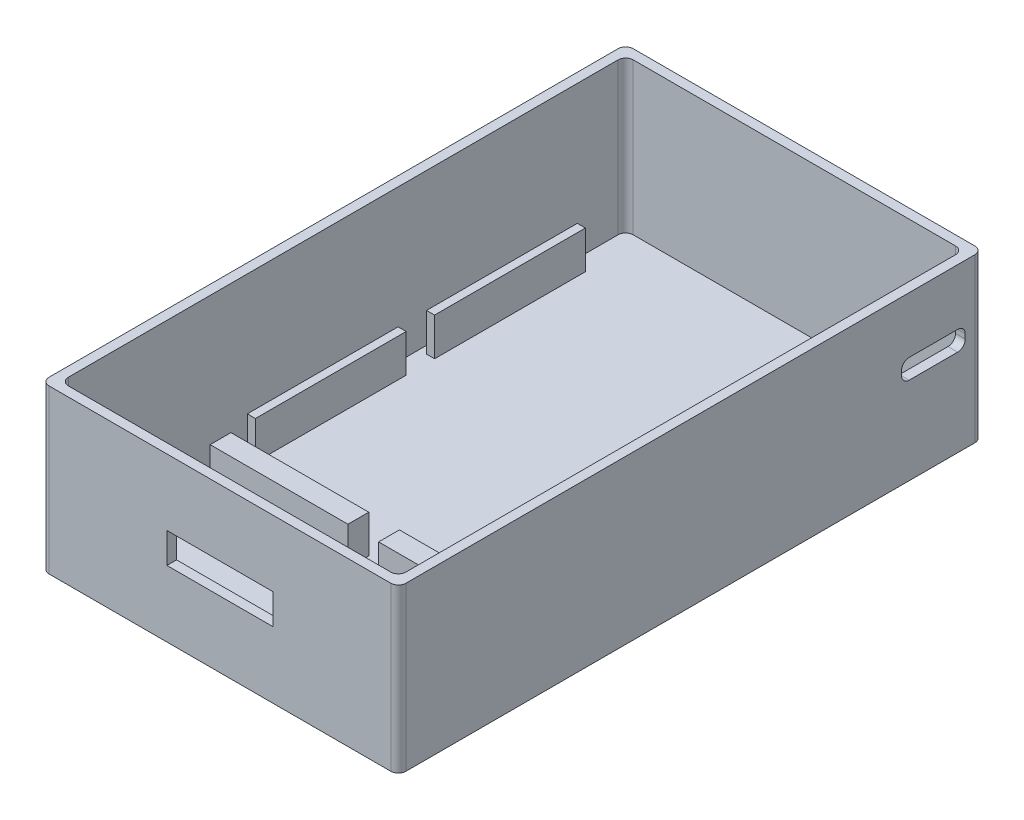
from build123d import *

# Parameters (mm, degrees)
SKETCH1_W           = 47.09116882
SKETCH1_H           = 77.09116882
BOSS_EXTRUDE1_DEPTH = 1.5
SKETCH2_W           = 47.09116882
SKETCH2_H           = 77.09116882
SKETCH2_W_2         = 44.545584412
SKETCH2_H_2         = 74.545584412
BOSS_EXTRUDE2_DEPTH = 20
FILLET4_R           = 1
CUT_EXTRUDE4_DEPTH  = 2
FILLET5_R           = 1
SKETCH10_W          = 18.187450175
SKETCH10_H          = 2.746977624
SKETCH10_W_2        = 18.187450176
SKETCH10_W_3        = 1.062839991
SKETCH10_H_2        = 19.895622202
SKETCH10_W_4        = 1.06283999
BOSS_EXTRUDE4_DEPTH = 5
SKETCH11_W          = 14
SKETCH11_H          = 4
CUT_EXTRUDE5_DEPTH  = 10


with BuildPart() as part:
    # Sketch1 → Boss-Extrude1 (new body)
    with BuildSketch(Plane(origin=(0, 0, 0), x_dir=(1, 0, 0), z_dir=(0, 1, 0))):
        with Locations((23.54558441, -38.54558441)):
            Rectangle(SKETCH1_W, SKETCH1_H)
    extrude(amount=BOSS_EXTRUDE1_DEPTH)

    # Sketch2 → Boss-Extrude2 (add)
    with BuildSketch(Plane(origin=(0, 1.5, 0), x_dir=(1, 0, 0), z_dir=(0, 1, 0))):
        with Locations((23.54558441, -38.54558441)):
            Rectangle(SKETCH2_W, SKETCH2_H)
        with Locations((23.545584412, -38.545584412)):
            Rectangle(SKETCH2_W_2, SKETCH2_H_2, mode=Mode.SUBTRACT)
    extrude(amount=BOSS_EXTRUDE2_DEPTH)

    # Fillet4
    fillet4_edges = [part.edges().sort_by_distance(p)[0] for p in [
        (45.818376618, 11.5, 1.272792206),
        (1.272792206, 11.5, 1.272792206),
        (45.818376618, 11.5, 75.818376618),
        (1.272792206, 11.5, 75.818376618),
        (47.09116882, 10.75, 0),
        (0, 10.75, 0),
        (47.09116882, 10.75, 77.09116882),
        (0, 10.75, 77.09116882),
    ]]
    fillet(fillet4_edges, radius=FILLET4_R)

    # Sketch9 → Cut-Extrude4 (cut)
    with BuildSketch(Plane(origin=(47.09116882, 0, 0), x_dir=(0, 0, -1), z_dir=(1, 0, 0))):
        Polygon((-10.672792206, 14.1), (-10.672792206, 11.5), (-10.310591422, 11.5), (-2.272792206, 11.5), (-2.272792206, 14.1), align=None)
    extrude(amount=-CUT_EXTRUDE4_DEPTH, mode=Mode.SUBTRACT)

    # Fillet5
    fillet5_edges = [part.edges().sort_by_distance(p)[0] for p in [
        (46.454772719, 14.1, 10.672792206),
        (46.454772719, 11.5, 2.272792206),
        (46.454772719, 14.1, 2.272792206),
        (46.454772719, 11.5, 10.672792206),
    ]]
    fillet(fillet5_edges, radius=FILLET5_R)

    # Sketch10 → Boss-Extrude4 (add)
    with BuildSketch(Plane(origin=(0, 1.5, 0), x_dir=(1, 0, 0), z_dir=(0, 1, 0))):
        with Locations((12.429357284, -56.800841985)):
            Rectangle(SKETCH10_W, SKETCH10_H)
        with Locations((34.66181154, -56.800841985)):
            Rectangle(SKETCH10_W_2, SKETCH10_H)
        with Locations((2.804212202, -42.251488371)):
            Rectangle(SKETCH10_W_3, SKETCH10_H_2)
        with Locations((2.804212202, -18.603217976)):
            Rectangle(SKETCH10_W_3, SKETCH10_H_2)
        with Locations((44.286956623, -18.603217976)):
            Rectangle(SKETCH10_W_4, SKETCH10_H_2)
        with Locations((44.286956623, -42.251488371)):
            Rectangle(SKETCH10_W_4, SKETCH10_H_2)
    extrude(amount=BOSS_EXTRUDE4_DEPTH)

    # Sketch11 → Cut-Extrude5 (cut)
    with BuildSketch(Plane.XY.offset(77.09116882)):
        with Locations((23.54558441, 10.756592615)):
            Rectangle(SKETCH11_W, SKETCH11_H)
    extrude(amount=-CUT_EXTRUDE5_DEPTH, mode=Mode.SUBTRACT)


solid = part.part
